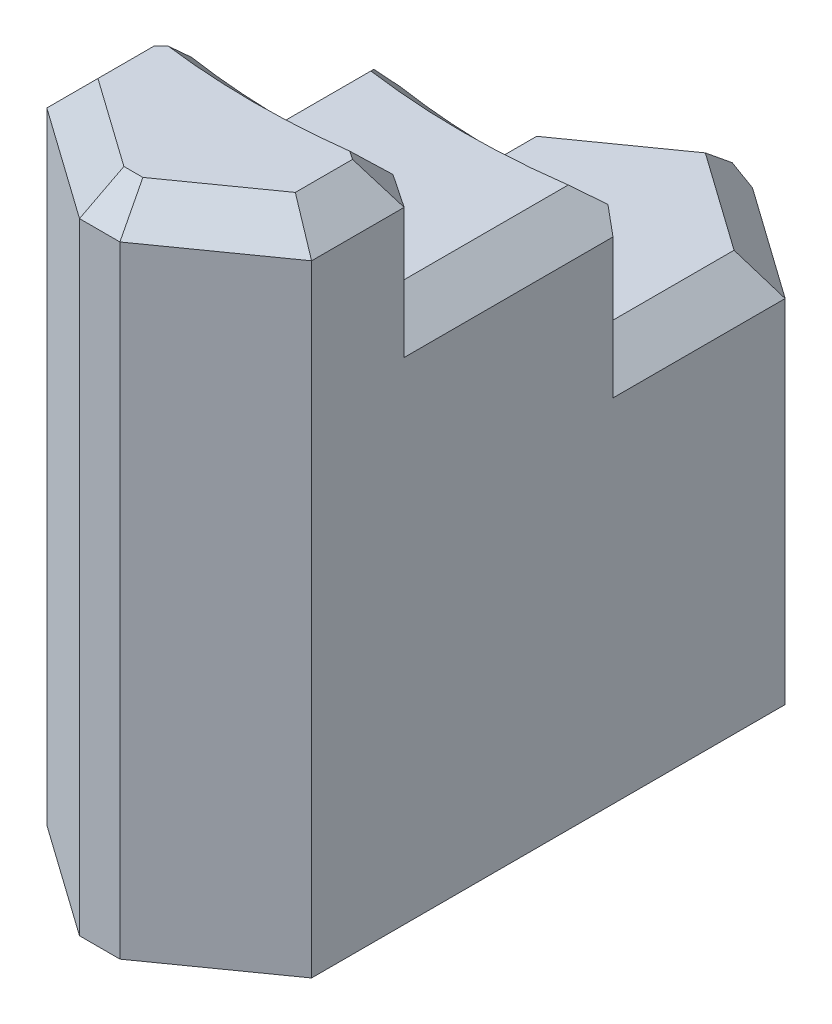
from build123d import *

# Parameters (mm, degrees)
EXTRUDE1_DEPTH     = 9.9822
CUT_EXTRUDE1_DEPTH = 36.749577377
SKETCH3_R          = 25.885731189
CUT_EXTRUDE2_DEPTH = 4.9022
SKETCH4_R          = 25.885731189
CUT_EXTRUDE3_DEPTH = 5.2578
CHAMFER1_SIZE      = 1.08172717
CHAMFER1_SIZE_2    = 1.27
CHAMFER2_SIZE      = 1.27
CHAMFER3_SIZE      = 1.27
CHAMFER4_SIZE      = 1.27


with BuildPart() as part:
    # Sketch1 → Extrude1 (new body)
    with BuildSketch(Plane(origin=(0, 0, 0), x_dir=(0, 0, -1), z_dir=(1, 0, 0))):
        Polygon((7.5692, 24.6888), (7.5692, 19.7866), (15.4432, 19.7866), (15.4432, 14.5288), (23.8506, 14.5288), (23.8506, 0), (0, 0), (0, 24.6888), align=None)
    extrude(amount=EXTRUDE1_DEPTH)

    # Sketch2 → Cut-Extrude1 (cut, through all)
    with BuildSketch(Plane(origin=(0, 24.6888, 0), x_dir=(1, 0, 0), z_dir=(0, 1, 0))):
        Polygon((0, 2.9972), (4.2291, 0), (0, 0), align=None)
        Polygon((9.9822, 2.9972), (9.9822, 0), (5.7531, 0), align=None)
        Polygon((0, 23.8506), (4.2291, 23.8506), (0, 20.8534), align=None)
        Polygon((9.9822, 20.8534), (9.9822, 23.8506), (5.7531, 23.8506), align=None)
    extrude(amount=-CUT_EXTRUDE1_DEPTH, mode=Mode.SUBTRACT)

    # Sketch3 → Cut-Extrude2 (cut)
    with BuildSketch(Plane(origin=(0, 24.6888, 0), x_dir=(1, 0, 0), z_dir=(0, 1, 0))):
        with Locations((4.9911, 32.9692)):
            Circle(SKETCH3_R)
    extrude(amount=-CUT_EXTRUDE2_DEPTH, mode=Mode.SUBTRACT)

    # Sketch4 → Cut-Extrude3 (cut)
    with BuildSketch(Plane(origin=(0, 19.7866, 0), x_dir=(1, 0, 0), z_dir=(0, 1, 0))):
        with Locations((4.9911, 40.8432)):
            Circle(SKETCH4_R)
    extrude(amount=-CUT_EXTRUDE3_DEPTH, mode=Mode.SUBTRACT)

    # Chamfer1
    # the kernel refuses this chamfer: 1.27, 1.08172717 mm, written as the material it takes off along each edge
    with BuildSketch(Plane(origin=(9.9822, 23.137823144, -15.4432), x_dir=(-0.9857782143008734, 0, 0.168051516535202), z_dir=(0, -1, 0))) as chamfer1_piece_1:
        with BuildLine():
            Line((1.303218251, 0), (CHAMFER1_SIZE * 0.168051516609, -CHAMFER1_SIZE * 0.985778214731))
            Line((CHAMFER1_SIZE * 0.168051516609, -CHAMFER1_SIZE * 0.985778214731), (0, 0))
            ThreePointArc((0, 0), (0.67003435, -0.008196065), (1.303218251, 0))
        make_face()
    extrude(amount=8.609023144, mode=Mode.SUBTRACT)
    with BuildSketch(Plane(origin=(9.9822, 28.040023144, -7.5692), x_dir=(0, 0, 1), z_dir=(0, -1, 0))) as chamfer1_piece_2:
        with BuildLine():
            Line((CHAMFER1_SIZE, 0), (0.219007803, 1.28468416))
            ThreePointArc((0.219007803, 1.28468416), (0.12067979, 0.659127904), (0, 0))
            Line((0, 0), (CHAMFER1_SIZE, 0))
        make_face()
    extrude(amount=8.253423144, mode=Mode.SUBTRACT)
    with BuildSketch(Plane(origin=(0, 27.954837395, -7.5692), x_dir=(0.9851028173062452, 0, 0.1719663901327771), z_dir=(0, -1, 0))) as chamfer1_piece_3:
        with BuildLine():
            Line((1.097600724, 0), (CHAMFER1_SIZE_2 * 0.171966390133, CHAMFER1_SIZE_2 * 0.985102817306))
            Line((CHAMFER1_SIZE_2 * 0.171966390133, CHAMFER1_SIZE_2 * 0.985102817306), (0, 0))
            ThreePointArc((0, 0), (0.563419729, 0.005814052), (1.097600724, 0))
        make_face()
    extrude(amount=8.168237395, mode=Mode.SUBTRACT)
    with BuildSketch(Plane(origin=(0, 23.052637395, -15.4432), x_dir=(0.985102817306246, 0, 0.17196639013277196), z_dir=(0, -1, 0))) as chamfer1_piece_4:
        with BuildLine():
            Line((1.097600724, 0), (CHAMFER1_SIZE_2 * 0.171966390133, CHAMFER1_SIZE_2 * 0.985102817306))
            Line((CHAMFER1_SIZE_2 * 0.171966390133, CHAMFER1_SIZE_2 * 0.985102817306), (0, 0))
            ThreePointArc((0, 0), (0.563419729, 0.005814052), (1.097600724, 0))
        make_face()
    extrude(amount=8.523837395, mode=Mode.SUBTRACT)

    # Chamfer2
    # the kernel refuses this chamfer: 1.27 mm, written as the material it takes off along each edge
    with BuildSketch(Plane(origin=(3.088405412, 24.6888, 1.88849226), x_dir=(0, -1, 0), z_dir=(0.8158799994392605, 0, -0.5782212608638604))) as chamfer2_piece_1:
        Polygon((CHAMFER2_SIZE, 0), (0, CHAMFER2_SIZE), (0, 0), align=None)
    extrude(amount=11.715557658, mode=Mode.SUBTRACT)
    with BuildSketch(Plane(origin=(0.963062605, 24.6888, 0), x_dir=(0, 0, -1), z_dir=(1, 0, 0))) as chamfer2_piece_2:
        Polygon((CHAMFER2_SIZE, 0), (0, -CHAMFER2_SIZE), (0, 0), align=None)
    extrude(amount=8.056074789, mode=Mode.SUBTRACT)
    with BuildSketch(Plane(origin=(-2.664694588, 24.6888, -4.88569226), x_dir=(0.5782212608638604, 0, -0.8158799994392603), z_dir=(0.8158799994392604, 0, 0.5782212608638605))) as chamfer2_piece_3:
        Polygon((CHAMFER2_SIZE, 0), (0, -CHAMFER2_SIZE), (0, 0), align=None)
    extrude(amount=11.715557658, mode=Mode.SUBTRACT)
    with BuildSketch(Plane(origin=(0, 24.6888, 0.268837395), x_dir=(1, 0, 0), z_dir=(0, 0, -1))) as chamfer2_piece_4:
        Polygon((CHAMFER2_SIZE, 0), (0, CHAMFER2_SIZE), (0, 0), align=None)
    extrude(amount=9.834074789, mode=Mode.SUBTRACT)
    with BuildSketch(Plane(origin=(3.390686755, 24.6888, -9.689886755), x_dir=(0.7071067811864264, 0, 0.7071067811866687), z_dir=(-0.7071067811866687, 0, 0.7071067811864264))) as chamfer2_piece_5:
        Polygon((CHAMFER2_SIZE, 0), (0, -CHAMFER2_SIZE), (0, 0), align=None)
    extrude(amount=8.061192589, mode=Mode.SUBTRACT)
    with BuildSketch(Plane(origin=(4.9911, 24.6888, -32.9692), x_dir=(-0.27423691753181434, 0, 0.9616621616049208), z_dir=(-0.9616621616049208, 0, -0.27423691753181434))) as chamfer2_piece_6:
        Polygon((25.885731189 + CHAMFER2_SIZE, 0), (25.885731189, -CHAMFER2_SIZE), (25.885731189, 0), align=None)
    revolve(axis=Axis((4.9911, 24.6888, -32.9692), (0, 1, 0)), revolution_arc=31.377850279, mode=Mode.SUBTRACT)
    with BuildSketch(Plane(origin=(12.693590923, 24.6888, -4.666659955), x_dir=(-0.5574990899678705, 0, 0.8301775500969635), z_dir=(-0.8301775500969636, 0, -0.5574990899678705))) as chamfer2_piece_7:
        Polygon((CHAMFER2_SIZE, 0), (0, -CHAMFER2_SIZE), (0, 0), align=None)
    extrude(amount=8.079556, mode=Mode.SUBTRACT)
    with BuildSketch(Plane(origin=(9.9822, 24.6888, 0.268837395), x_dir=(-1, 0, 0), z_dir=(0, 0, -1))) as chamfer2_piece_8:
        Polygon((CHAMFER2_SIZE, 0), (0, -CHAMFER2_SIZE), (0, 0), align=None)
    extrude(amount=10.022347619, mode=Mode.SUBTRACT)
    with BuildSketch(Plane(origin=(9.9822, 14.5288, -24.119437395), x_dir=(-1, 0, 0), z_dir=(0, 0, 1))) as chamfer2_piece_9_section:
        Polygon((CHAMFER2_SIZE, 0), (0, CHAMFER2_SIZE), (0, 0), align=None)
    chamfer2_piece_9 = extrude(amount=13.02400196, mode=Mode.PRIVATE)
    chamfer2_piece_9 = split(chamfer2_piece_9, bisect_by=Plane(origin=(5.465987334, 14.5288, -17.394299305), z_dir=(0.5574990901783627, 0, -0.8301775499556092)), keep=Keep.TOP, mode=Mode.PRIVATE)
    add(chamfer2_piece_9, mode=Mode.SUBTRACT)
    with BuildSketch(Plane(origin=(0, 14.5288, -10.907162605), x_dir=(1, 0, 0), z_dir=(0, 0, -1))) as chamfer2_piece_10_section:
        Polygon((CHAMFER2_SIZE, 0), (0, CHAMFER2_SIZE), (0, 0), align=None)
    chamfer2_piece_10 = extrude(amount=13.212274789, mode=Mode.PRIVATE)
    chamfer2_piece_10 = split(chamfer2_piece_10, bisect_by=Plane(origin=(-1.633018697, 14.5288, -12.540181303), z_dir=(-0.7071067811864264, 0, -0.7071067811866687)), keep=Keep.TOP, mode=Mode.PRIVATE)
    chamfer2_piece_10 = chamfer2_piece_10 - Plane(origin=(4.9911, 14.5288, -40.8432), x_dir=(1, 0, 0), z_dir=(0, 1, 0)) * Cylinder(25.885731189, 32, mode=Mode.PRIVATE)
    add(chamfer2_piece_10, mode=Mode.SUBTRACT)
    with BuildSketch(Plane(origin=(0, 14.5288, -10.907162605), x_dir=(1, 0, 0), z_dir=(0, 0, -1))) as chamfer2_piece_11_section:
        Polygon((CHAMFER2_SIZE, 0), (0, CHAMFER2_SIZE), (0, 0), align=None)
    chamfer2_piece_11 = extrude(amount=13.212274789, mode=Mode.PRIVATE)
    chamfer2_piece_11 = split(chamfer2_piece_11, bisect_by=Plane(origin=(-1.633018697, 14.5288, -12.540181303), z_dir=(0.7071067811864264, 0, 0.7071067811866687)), keep=Keep.TOP, mode=Mode.PRIVATE)
    chamfer2_piece_11 = chamfer2_piece_11 & Plane(origin=(4.9911, 14.5288, -40.8432), x_dir=(1, 0, 0), z_dir=(0, 1, 0)) * Cylinder(25.885731189, 32, mode=Mode.PRIVATE)
    add(chamfer2_piece_11, mode=Mode.SUBTRACT)
    with BuildSketch(Plane(origin=(0, 14.5288, -10.907162605), x_dir=(1, 0, 0), z_dir=(0, 0, -1))) as chamfer2_piece_12_section:
        Polygon((CHAMFER2_SIZE, 0), (0, CHAMFER2_SIZE), (0, 0), align=None)
    chamfer2_piece_12 = extrude(amount=13.212274789, mode=Mode.PRIVATE)
    chamfer2_piece_12 = split(chamfer2_piece_12, bisect_by=Plane(origin=(-1.633018697, 14.5288, -12.540181303), z_dir=(-0.7071067811864264, 0, -0.7071067811866687)), keep=Keep.TOP, mode=Mode.PRIVATE)
    chamfer2_piece_12 = chamfer2_piece_12 & Plane(origin=(4.9911, 14.5288, -40.8432), x_dir=(1, 0, 0), z_dir=(0, 1, 0)) * Cylinder(25.885731189, 32, mode=Mode.PRIVATE)
    add(chamfer2_piece_12, mode=Mode.SUBTRACT)
    with BuildSketch(Plane(origin=(0, 19.7866, -17.439237395), x_dir=(1, 0, 0), z_dir=(0, 0, 1))) as chamfer2_piece_13_section:
        Polygon((CHAMFER2_SIZE, 0), (0, -CHAMFER2_SIZE), (0, 0), align=None)
    chamfer2_piece_13 = extrude(amount=14.406074789, mode=Mode.PRIVATE)
    chamfer2_piece_13 = chamfer2_piece_13 & Plane(origin=(4.9911, 19.7866, -32.9692), x_dir=(1, 0, 0), z_dir=(0, 1, 0)) * Cylinder(25.885731189, 34, mode=Mode.PRIVATE)
    chamfer2_piece_13 = split(chamfer2_piece_13, bisect_by=Plane(origin=(5.570018697, 19.7866, -11.869218697), z_dir=(-0.7071067811864264, 0, -0.7071067811866687)), keep=Keep.TOP, mode=Mode.PRIVATE)
    add(chamfer2_piece_13, mode=Mode.SUBTRACT)
    with BuildSketch(Plane(origin=(0, 19.7866, -17.439237395), x_dir=(1, 0, 0), z_dir=(0, 0, 1))) as chamfer2_piece_14_section:
        Polygon((CHAMFER2_SIZE, 0), (0, -CHAMFER2_SIZE), (0, 0), align=None)
    chamfer2_piece_14 = extrude(amount=14.406074789, mode=Mode.PRIVATE)
    chamfer2_piece_14 = chamfer2_piece_14 - Plane(origin=(4.9911, 19.7866, -32.9692), x_dir=(1, 0, 0), z_dir=(0, 1, 0)) * Cylinder(25.885731189, 34, mode=Mode.PRIVATE)
    chamfer2_piece_14 = split(chamfer2_piece_14, bisect_by=Plane(origin=(5.570018697, 19.7866, -11.869218697), z_dir=(-0.7071067811864264, 0, -0.7071067811866687)), keep=Keep.TOP, mode=Mode.PRIVATE)
    add(chamfer2_piece_14, mode=Mode.SUBTRACT)
    with BuildSketch(Plane(origin=(0, 19.7866, -17.439237395), x_dir=(1, 0, 0), z_dir=(0, 0, 1))) as chamfer2_piece_15_section:
        Polygon((CHAMFER2_SIZE, 0), (0, -CHAMFER2_SIZE), (0, 0), align=None)
    chamfer2_piece_15 = extrude(amount=14.406074789, mode=Mode.PRIVATE)
    chamfer2_piece_15 = chamfer2_piece_15 & Plane(origin=(4.9911, 19.7866, -32.9692), x_dir=(1, 0, 0), z_dir=(0, 1, 0)) * Cylinder(25.885731189, 34, mode=Mode.PRIVATE)
    chamfer2_piece_15 = split(chamfer2_piece_15, bisect_by=Plane(origin=(5.570018697, 19.7866, -11.869218697), z_dir=(0.7071067811864264, 0, 0.7071067811866687)), keep=Keep.TOP, mode=Mode.PRIVATE)
    add(chamfer2_piece_15, mode=Mode.SUBTRACT)
    with BuildSketch(Plane(origin=(9.9822, 19.7866, -3.221435435), x_dir=(-1, 0, 0), z_dir=(0, 0, -1))) as chamfer2_piece_16_section:
        Polygon((CHAMFER2_SIZE, 0), (0, -CHAMFER2_SIZE), (0, 0), align=None)
    chamfer2_piece_16 = extrude(amount=14.406074789, mode=Mode.PRIVATE)
    chamfer2_piece_16 = split(chamfer2_piece_16, bisect_by=Plane(origin=(11.493797972, 19.7866, -5.472371309), z_dir=(0.5574990899678705, 0, -0.8301775500969636)), keep=Keep.TOP, mode=Mode.PRIVATE)
    add(chamfer2_piece_16, mode=Mode.SUBTRACT)

    # Chamfer3
    chamfer3_edges = [part.edges().sort_by_distance(p)[0] for p in [
        (7.23265, 14.5288, -22.80203003),
        (4.983681173, 19.7866, -14.957469874),
    ]]
    chamfer(chamfer3_edges, length=CHAMFER3_SIZE)

    # Chamfer4
    chamfer4_edges = [part.edges().sort_by_distance(p)[0] for p in [
        (2.581452238, 14.5288, -22.682897683),
    ]]
    chamfer(chamfer4_edges, length=CHAMFER4_SIZE)


solid = part.part
